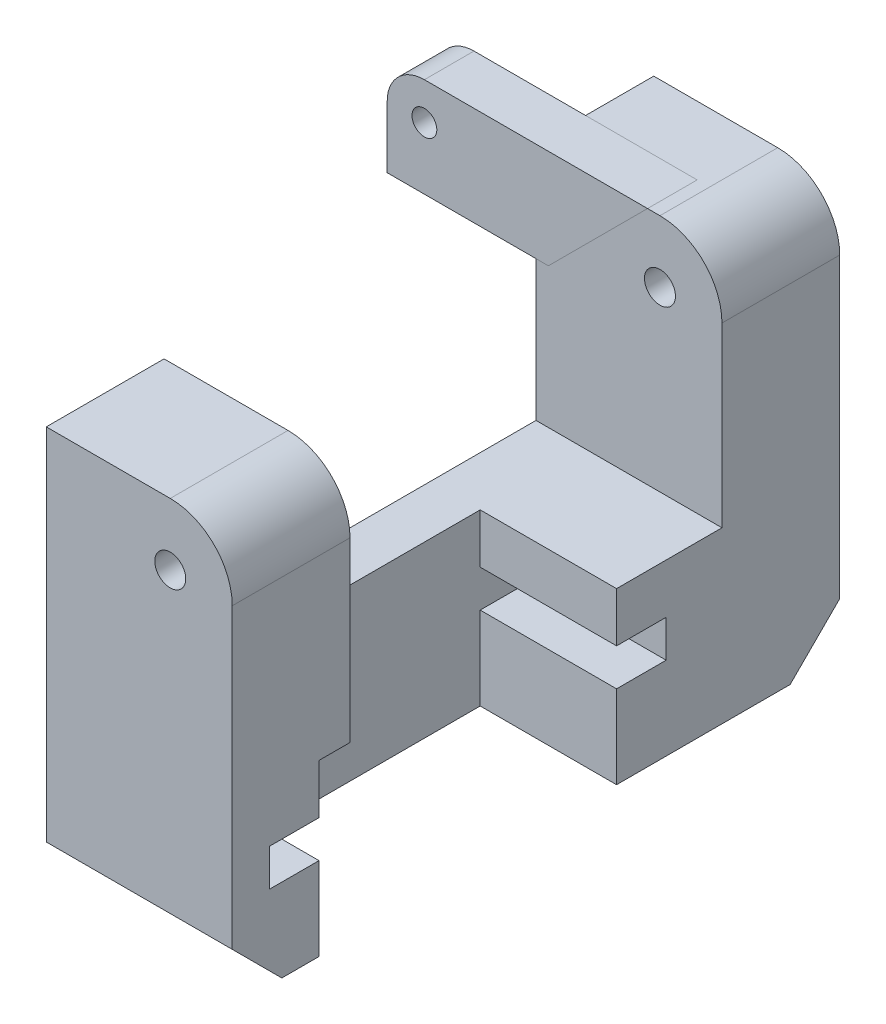
from build123d import *

# Parameters (mm, degrees)
SKETCH1_W           = 49
SKETCH1_H           = 33
BOSS_EXTRUDE1_DEPTH = 7.5
SKETCH2_R           = 1.25
CUT_EXTRUDE1_DEPTH  = 53.244616948
SKETCH3_W           = 24
SKETCH3_H           = 6.7
CUT_EXTRUDE2_DEPTH  = 11
CUT_EXTRUDE3_DEPTH  = 32.519835025
CUT_EXTRUDE4_REACH  = 43.779
SKETCH5_W           = 15
SKETCH5_H           = 30
SKETCH6_W           = 5
SKETCH6_H           = 8
CUT_EXTRUDE5_DEPTH  = 4
CHAMFER1_SIZE       = 4
SKETCH7_R           = 1
BOSS_EXTRUDE2_DEPTH = 4
FILLET1_R           = 3
CHAMFER2_SIZE       = 4


with BuildPart() as part:
    # Sketch1 → Boss-Extrude1 (new, symmetric)
    with BuildSketch(Plane(origin=(0, 0, 0), x_dir=(0, 0, -1), z_dir=(1, 0, 0))):
        Rectangle(SKETCH1_W, SKETCH1_H)
    extrude(amount=BOSS_EXTRUDE1_DEPTH, both=True)

    # Sketch2 → Cut-Extrude1 (cut, through all)
    with BuildSketch(Plane.XY.offset(24.5)):
        with Locations((2.5, 11.5)):
            Circle(SKETCH2_R)
        with BuildLine():
            Line((2.5, 16.5), (7.5, 16.5))
            Line((7.5, 16.5), (7.5, 11.5))
            ThreePointArc((7.5, 11.5), (6.035533906, 15.035533906), (2.5, 16.5))
        make_face()
    extrude(amount=-CUT_EXTRUDE1_DEPTH, mode=Mode.SUBTRACT)

    # Sketch3 → Cut-Extrude2 (cut)
    with BuildSketch(Plane(origin=(7.5, 0, 0), x_dir=(0, 0, -1), z_dir=(1, 0, 0))):
        with Locations((-5.5, -13.15)):
            Rectangle(SKETCH3_W, SKETCH3_H)
    extrude(amount=-CUT_EXTRUDE2_DEPTH, mode=Mode.SUBTRACT)

    # Sketch4 → Cut-Extrude3 (cut, through all)
    with BuildSketch(Plane(origin=(-3.5, 0, 0), x_dir=(0, 0, -1), z_dir=(1, 0, 0))):
        Polygon((6.5, -6.8), (10.5, -6.8), (10.5, -9.8), (-21.5, -9.8), (-21.5, -6.8), (-17.5, -6.8), (-17.5, -2.8), (6.5, -2.8), align=None)
    extrude(amount=CUT_EXTRUDE3_DEPTH, mode=Mode.SUBTRACT)

    # Cut-Extrude4: up to this face of the body (flat: up to its plane)
    cut_extrude4_end = Plane(part.part.faces().sort_by_distance((2, -2.8, 5.5))[0])
    # Sketch5 → Cut-Extrude4 (cut, up to the picked face)
    with BuildSketch(Plane(origin=(0, 16.5, 0), x_dir=(1, 0, 0), z_dir=(0, 1, 0)), mode=Mode.PRIVATE) as cut_extrude4_sk1:
        Rectangle(SKETCH5_W, SKETCH5_H)
    cut_extrude4_tool1 = split(extrude(cut_extrude4_sk1.sketch, amount=-CUT_EXTRUDE4_REACH, mode=Mode.PRIVATE), bisect_by=cut_extrude4_end, keep=Keep.BOTH, mode=Mode.PRIVATE)
    add(cut_extrude4_tool1.solids().sort_by(Axis((0, 16.5, 0), (0, -1, 0)))[0], mode=Mode.SUBTRACT)

    # Sketch6 → Cut-Extrude5 (cut)
    with BuildSketch(Plane.XY.offset(-15)):
        with Locations((-5, 12.5)):
            Rectangle(SKETCH6_W, SKETCH6_H)
    extrude(amount=-CUT_EXTRUDE5_DEPTH, mode=Mode.SUBTRACT)

    # Chamfer1
    chamfer1_edges = [part.edges().sort_by_distance(p)[0] for p in [
        (-2.5, 8.5, -17),
    ]]
    chamfer(chamfer1_edges, length=CHAMFER1_SIZE)
    chamfer1_2_edges = [part.edges().sort_by_distance(p)[0] for p in [
        (-2.5, 16.5, -17),
    ]]
    chamfer(chamfer1_2_edges, length=CHAMFER1_SIZE - 0.0001)  # a hair under: the kernel refuses the full size

    # Chamfer2
    chamfer2_edges = [part.edges().sort_by_distance(p)[0] for p in [
        (0, -16.5, -24.5),
        (0, -16.5, 24.5),
    ]]
    chamfer(chamfer2_edges, length=CHAMFER2_SIZE)


with BuildPart() as body_2:
    # Sketch7 → Boss-Extrude2 (new body)
    with BuildSketch(Plane.XY.offset(-19)):
        Polygon((1.5, 16.5), (-19.5, 16.5), (-19.5, 8.5), (-6.5, 8.5), align=None)
        with Locations(Location((-16.5, 13.5, 0), (0, 0, 180))):
            Circle(SKETCH7_R, mode=Mode.SUBTRACT)
    extrude(amount=BOSS_EXTRUDE2_DEPTH)

    # Fillet1
    fillet1_edges = [body_2.edges().sort_by_distance(p)[0] for p in [
        (-19.5, 16.5, -17),
    ]]
    fillet(fillet1_edges, radius=FILLET1_R)


solid = Compound([part.part, body_2.part])
